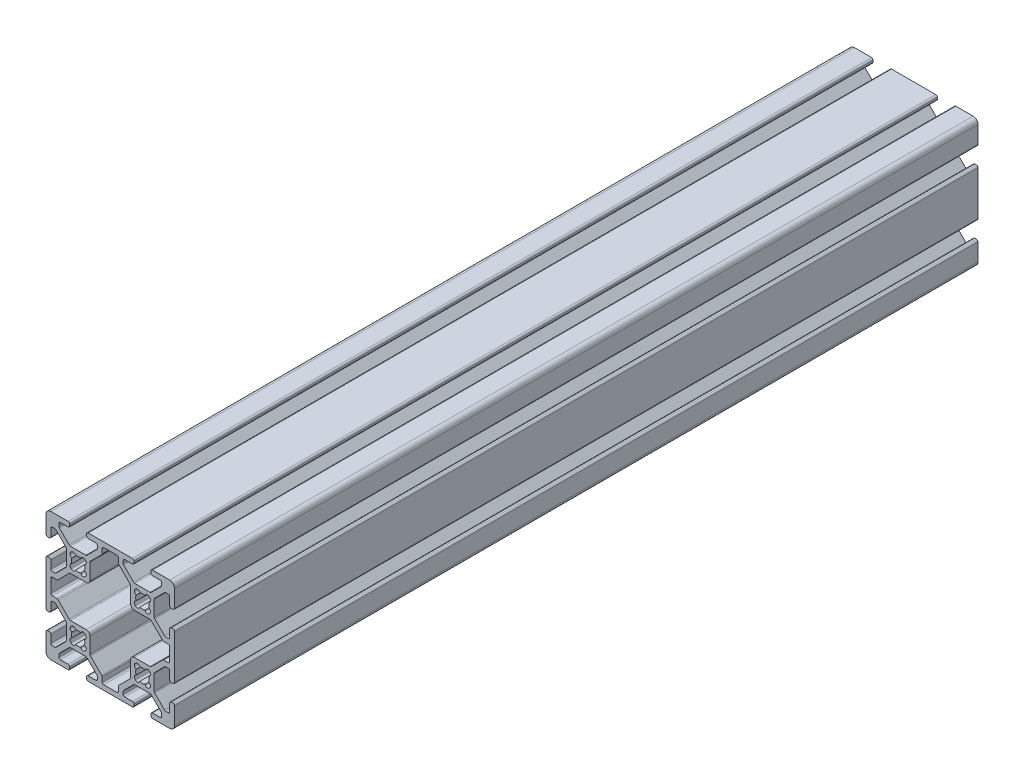
from build123d import *

# Parameters (mm, degrees)
EXTRUDE1_DEPTH = 250


with BuildPart() as part:
    # Sketch1 → Extrude1 (new body)
    with BuildSketch(Plane.XY):
        with BuildLine():
            Line((-22.383919339, -3.655), (-17.616080661, -3.655))
            ThreePointArc((-17.616080661, -3.655), (-17.421677478, -3.693669197), (-17.256870417, -3.803789755))
            Line((-17.256870417, -3.803789755), (-14.153789755, -6.906870417))
            ThreePointArc((-14.153789755, -6.906870417), (-14.043669197, -7.071677478), (-14.005, -7.266080661))
            Line((-14.005, -7.266080661), (-14.005, -7.992))
            ThreePointArc((-14.005, -7.992), (-14.153789755, -8.351210245), (-14.513, -8.5))
            Line((-14.513, -8.5), (-16.862, -8.5))
            ThreePointArc((-16.862, -8.5), (-17.221210245, -8.648789755), (-17.37, -9.008))
            Line((-17.37, -9.008), (-17.37, -9.492))
            ThreePointArc((-17.37, -9.492), (-17.221210245, -9.851210245), (-16.862, -10))
            Line((-16.862, -10), (-3.138, -10))
            ThreePointArc((-3.138, -10), (-2.778789755, -9.851210245), (-2.63, -9.492))
            Line((-2.63, -9.492), (-2.63, -9.008))
            ThreePointArc((-2.63, -9.008), (-2.778789755, -8.648789755), (-3.138, -8.5))
            Line((-3.138, -8.5), (-5.487, -8.5))
            ThreePointArc((-5.487, -8.5), (-5.846210245, -8.351210245), (-5.995, -7.992))
            Line((-5.995, -7.992), (-5.995, -7.266080661))
            ThreePointArc((-5.995, -7.266080661), (-5.956330803, -7.071677478), (-5.846210245, -6.906870417))
            Line((-5.846210245, -6.906870417), (-2.743129583, -3.803789755))
            ThreePointArc((-2.743129583, -3.803789755), (-2.578322522, -3.693669197), (-2.383919339, -3.655))
            Line((-2.383919339, -3.655), (2.383919339, -3.655))
            ThreePointArc((2.383919339, -3.655), (2.578322522, -3.693669197), (2.743129583, -3.803789755))
            Line((2.743129583, -3.803789755), (5.846210245, -6.906870417))
            ThreePointArc((5.846210245, -6.906870417), (5.956330803, -7.071677478), (5.995, -7.266080661))
            Line((5.995, -7.266080661), (5.995, -7.992))
            ThreePointArc((5.995, -7.992), (5.846210245, -8.351210245), (5.487, -8.5))
            Line((5.487, -8.5), (3.138, -8.5))
            ThreePointArc((3.138, -8.5), (2.778789755, -8.648789755), (2.63, -9.008))
            Line((2.63, -9.008), (2.63, -9.492))
            ThreePointArc((2.63, -9.492), (2.778789755, -9.851210245), (3.138, -10))
            Line((3.138, -10), (8.5, -10))
            ThreePointArc((8.5, -10), (9.560660172, -9.560660172), (10, -8.5))
            Line((10, -8.5), (10, -3.138))
            ThreePointArc((10, -3.138), (9.851210245, -2.778789755), (9.492, -2.63))
            Line((9.492, -2.63), (9.008, -2.63))
            ThreePointArc((9.008, -2.63), (8.648789755, -2.778789755), (8.5, -3.138))
            Line((8.5, -3.138), (8.5, -5.487))
            ThreePointArc((8.5, -5.487), (8.351210245, -5.846210245), (7.992, -5.995))
            Line((7.992, -5.995), (7.266080661, -5.995))
            ThreePointArc((7.266080661, -5.995), (7.071677478, -5.956330803), (6.906870417, -5.846210245))
            Line((6.906870417, -5.846210245), (3.803789755, -2.743129583))
            ThreePointArc((3.803789755, -2.743129583), (3.693669197, -2.578322522), (3.655, -2.383919339))
            Line((3.655, -2.383919339), (3.655, 2.383919339))
            ThreePointArc((3.655, 2.383919339), (3.693669197, 2.578322522), (3.803789755, 2.743129583))
            Line((3.803789755, 2.743129583), (6.906870417, 5.846210245))
            ThreePointArc((6.906870417, 5.846210245), (7.071677478, 5.956330803), (7.266080661, 5.995))
            Line((7.266080661, 5.995), (7.992, 5.995))
            ThreePointArc((7.992, 5.995), (8.351210245, 5.846210245), (8.5, 5.487))
            Line((8.5, 5.487), (8.5, 3.138))
            ThreePointArc((8.5, 3.138), (8.648789755, 2.778789755), (9.008, 2.63))
            Line((9.008, 2.63), (9.492, 2.63))
            ThreePointArc((9.492, 2.63), (9.851210245, 2.778789755), (10, 3.138))
            Line((10, 3.138), (10, 16.862))
            ThreePointArc((10, 16.862), (9.851210245, 17.221210245), (9.492, 17.37))
            Line((9.492, 17.37), (9.008, 17.37))
            ThreePointArc((9.008, 17.37), (8.648789755, 17.221210245), (8.5, 16.862))
            Line((8.5, 16.862), (8.5, 14.513))
            ThreePointArc((8.5, 14.513), (8.351210245, 14.153789755), (7.992, 14.005))
            Line((7.992, 14.005), (7.266080661, 14.005))
            ThreePointArc((7.266080661, 14.005), (7.071677478, 14.043669197), (6.906870417, 14.153789755))
            Line((6.906870417, 14.153789755), (3.803789755, 17.256870417))
            ThreePointArc((3.803789755, 17.256870417), (3.693669197, 17.421677478), (3.655, 17.616080661))
            Line((3.655, 17.616080661), (3.655, 22.383919339))
            ThreePointArc((3.655, 22.383919339), (3.693669197, 22.578322522), (3.803789755, 22.743129583))
            Line((3.803789755, 22.743129583), (6.906870417, 25.846210245))
            ThreePointArc((6.906870417, 25.846210245), (7.071677478, 25.956330803), (7.266080661, 25.995))
            Line((7.266080661, 25.995), (7.992, 25.995))
            ThreePointArc((7.992, 25.995), (8.351210245, 25.846210245), (8.5, 25.487))
            Line((8.5, 25.487), (8.5, 23.138))
            ThreePointArc((8.5, 23.138), (8.648789755, 22.778789755), (9.008, 22.63))
            Line((9.008, 22.63), (9.492, 22.63))
            ThreePointArc((9.492, 22.63), (9.851210245, 22.778789755), (10, 23.138))
            Line((10, 23.138), (10, 28.5))
            ThreePointArc((10, 28.5), (9.560660172, 29.560660172), (8.5, 30))
            Line((8.5, 30), (3.138, 30))
            ThreePointArc((3.138, 30), (2.778789755, 29.851210245), (2.63, 29.492))
            Line((2.63, 29.492), (2.63, 29.008))
            ThreePointArc((2.63, 29.008), (2.778789755, 28.648789755), (3.138, 28.5))
            Line((3.138, 28.5), (5.487, 28.5))
            ThreePointArc((5.487, 28.5), (5.846210245, 28.351210245), (5.995, 27.992))
            Line((5.995, 27.992), (5.995, 27.266080661))
            ThreePointArc((5.995, 27.266080661), (5.956330803, 27.071677478), (5.846210245, 26.906870417))
            Line((5.846210245, 26.906870417), (2.743129583, 23.803789755))
            ThreePointArc((2.743129583, 23.803789755), (2.578322522, 23.693669197), (2.383919339, 23.655))
            Line((2.383919339, 23.655), (-2.383919339, 23.655))
            ThreePointArc((-2.383919339, 23.655), (-2.578322522, 23.693669197), (-2.743129583, 23.803789755))
            Line((-2.743129583, 23.803789755), (-5.846210245, 26.906870417))
            ThreePointArc((-5.846210245, 26.906870417), (-5.956330803, 27.071677478), (-5.995, 27.266080661))
            Line((-5.995, 27.266080661), (-5.995, 27.992))
            ThreePointArc((-5.995, 27.992), (-5.846210245, 28.351210245), (-5.487, 28.5))
            Line((-5.487, 28.5), (-3.138, 28.5))
            ThreePointArc((-3.138, 28.5), (-2.778789755, 28.648789755), (-2.63, 29.008))
            Line((-2.63, 29.008), (-2.63, 29.492))
            ThreePointArc((-2.63, 29.492), (-2.778789755, 29.851210245), (-3.138, 30))
            Line((-3.138, 30), (-16.862, 30))
            ThreePointArc((-16.862, 30), (-17.221210245, 29.851210245), (-17.37, 29.492))
            Line((-17.37, 29.492), (-17.37, 29.008))
            ThreePointArc((-17.37, 29.008), (-17.221210245, 28.648789755), (-16.862, 28.5))
            Line((-16.862, 28.5), (-14.513, 28.5))
            ThreePointArc((-14.513, 28.5), (-14.153789755, 28.351210245), (-14.005, 27.992))
            Line((-14.005, 27.992), (-14.005, 27.266080661))
            ThreePointArc((-14.005, 27.266080661), (-14.043669197, 27.071677478), (-14.153789755, 26.906870417))
            Line((-14.153789755, 26.906870417), (-17.256870417, 23.803789755))
            ThreePointArc((-17.256870417, 23.803789755), (-17.421677478, 23.693669197), (-17.616080661, 23.655))
            Line((-17.616080661, 23.655), (-22.383919339, 23.655))
            ThreePointArc((-22.383919339, 23.655), (-22.578322522, 23.693669197), (-22.743129583, 23.803789755))
            Line((-22.743129583, 23.803789755), (-25.846210245, 26.906870417))
            ThreePointArc((-25.846210245, 26.906870417), (-25.956330803, 27.071677478), (-25.995, 27.266080661))
            Line((-25.995, 27.266080661), (-25.995, 27.992))
            ThreePointArc((-25.995, 27.992), (-25.846210245, 28.351210245), (-25.487, 28.5))
            Line((-25.487, 28.5), (-23.138, 28.5))
            ThreePointArc((-23.138, 28.5), (-22.778789755, 28.648789755), (-22.63, 29.008))
            Line((-22.63, 29.008), (-22.63, 29.492))
            ThreePointArc((-22.63, 29.492), (-22.778789755, 29.851210245), (-23.138, 30))
            Line((-23.138, 30), (-28.5, 30))
            ThreePointArc((-28.5, 30), (-29.560660172, 29.560660172), (-30, 28.5))
            Line((-30, 28.5), (-30, 23.138))
            ThreePointArc((-30, 23.138), (-29.851210245, 22.778789755), (-29.492, 22.63))
            Line((-29.492, 22.63), (-29.008, 22.63))
            ThreePointArc((-29.008, 22.63), (-28.648789755, 22.778789755), (-28.5, 23.138))
            Line((-28.5, 23.138), (-28.5, 25.487))
            ThreePointArc((-28.5, 25.487), (-28.351210245, 25.846210245), (-27.992, 25.995))
            Line((-27.992, 25.995), (-27.266080661, 25.995))
            ThreePointArc((-27.266080661, 25.995), (-27.071677478, 25.956330803), (-26.906870417, 25.846210245))
            Line((-26.906870417, 25.846210245), (-23.803789755, 22.743129583))
            ThreePointArc((-23.803789755, 22.743129583), (-23.693669197, 22.578322522), (-23.655, 22.383919339))
            Line((-23.655, 22.383919339), (-23.655, 17.616080661))
            ThreePointArc((-23.655, 17.616080661), (-23.693669197, 17.421677478), (-23.803789755, 17.256870417))
            Line((-23.803789755, 17.256870417), (-26.906870417, 14.153789755))
            ThreePointArc((-26.906870417, 14.153789755), (-27.071677478, 14.043669197), (-27.266080661, 14.005))
            Line((-27.266080661, 14.005), (-27.992, 14.005))
            ThreePointArc((-27.992, 14.005), (-28.351210245, 14.153789755), (-28.5, 14.513))
            Line((-28.5, 14.513), (-28.5, 16.862))
            ThreePointArc((-28.5, 16.862), (-28.648789755, 17.221210245), (-29.008, 17.37))
            Line((-29.008, 17.37), (-29.492, 17.37))
            ThreePointArc((-29.492, 17.37), (-29.851210245, 17.221210245), (-30, 16.862))
            Line((-30, 16.862), (-30, 3.138))
            ThreePointArc((-30, 3.138), (-29.851210245, 2.778789755), (-29.492, 2.63))
            Line((-29.492, 2.63), (-29.008, 2.63))
            ThreePointArc((-29.008, 2.63), (-28.648789755, 2.778789755), (-28.5, 3.138))
            Line((-28.5, 3.138), (-28.5, 5.487))
            ThreePointArc((-28.5, 5.487), (-28.351210245, 5.846210245), (-27.992, 5.995))
            Line((-27.992, 5.995), (-27.266080661, 5.995))
            ThreePointArc((-27.266080661, 5.995), (-27.071677478, 5.956330803), (-26.906870417, 5.846210245))
            Line((-26.906870417, 5.846210245), (-23.803789755, 2.743129583))
            ThreePointArc((-23.803789755, 2.743129583), (-23.693669197, 2.578322522), (-23.655, 2.383919339))
            Line((-23.655, 2.383919339), (-23.655, -2.383919339))
            ThreePointArc((-23.655, -2.383919339), (-23.693669197, -2.578322522), (-23.803789755, -2.743129583))
            Line((-23.803789755, -2.743129583), (-26.906870417, -5.846210245))
            ThreePointArc((-26.906870417, -5.846210245), (-27.071677478, -5.956330803), (-27.266080661, -5.995))
            Line((-27.266080661, -5.995), (-27.992, -5.995))
            ThreePointArc((-27.992, -5.995), (-28.351210245, -5.846210245), (-28.5, -5.487))
            Line((-28.5, -5.487), (-28.5, -3.138))
            ThreePointArc((-28.5, -3.138), (-28.648789755, -2.778789755), (-29.008, -2.63))
            Line((-29.008, -2.63), (-29.492, -2.63))
            ThreePointArc((-29.492, -2.63), (-29.851210245, -2.778789755), (-30, -3.138))
            Line((-30, -3.138), (-30, -8.5))
            ThreePointArc((-30, -8.5), (-29.560660172, -9.560660172), (-28.5, -10))
            Line((-28.5, -10), (-23.138, -10))
            ThreePointArc((-23.138, -10), (-22.778789755, -9.851210245), (-22.63, -9.492))
            Line((-22.63, -9.492), (-22.63, -9.008))
            ThreePointArc((-22.63, -9.008), (-22.778789755, -8.648789755), (-23.138, -8.5))
            Line((-23.138, -8.5), (-25.487, -8.5))
            ThreePointArc((-25.487, -8.5), (-25.846210245, -8.351210245), (-25.995, -7.992))
            Line((-25.995, -7.992), (-25.995, -7.266080661))
            ThreePointArc((-25.995, -7.266080661), (-25.956330803, -7.071677478), (-25.846210245, -6.906870417))
            Line((-25.846210245, -6.906870417), (-22.743129583, -3.803789755))
            ThreePointArc((-22.743129583, -3.803789755), (-22.578322522, -3.693669197), (-22.383919339, -3.655))
        make_face()
        with BuildLine():
            Line((-2.124900844, 17.695494034), (-2.304505966, 17.875099156))
            ThreePointArc((-2.304505966, 17.875099156), (-2.505938017, 18.643532189), (-1.935133506, 19.196023282))
            ThreePointArc((-1.935133506, 19.196023282), (-2.0955, 20), (-1.935133506, 20.803976718))
            ThreePointArc((-1.935133506, 20.803976718), (-2.505938017, 21.356467811), (-2.304505966, 22.124900844))
            Line((-2.304505966, 22.124900844), (-2.124900844, 22.304505966))
            ThreePointArc((-2.124900844, 22.304505966), (-1.356467811, 22.505938017), (-0.803976718, 21.935133506))
            ThreePointArc((-0.803976718, 21.935133506), (0, 22.0955), (0.803976718, 21.935133506))
            ThreePointArc((0.803976718, 21.935133506), (1.356467811, 22.505938017), (2.124900844, 22.304505966))
            Line((2.124900844, 22.304505966), (2.304505966, 22.124900844))
            ThreePointArc((2.304505966, 22.124900844), (2.505938017, 21.356467811), (1.935133506, 20.803976718))
            ThreePointArc((1.935133506, 20.803976718), (2.0955, 20), (1.935133506, 19.196023282))
            ThreePointArc((1.935133506, 19.196023282), (2.505938017, 18.643532189), (2.304505966, 17.875099156))
            Line((2.304505966, 17.875099156), (2.124900844, 17.695494034))
            ThreePointArc((2.124900844, 17.695494034), (1.356467811, 17.494061983), (0.803976718, 18.064866494))
            ThreePointArc((0.803976718, 18.064866494), (0, 17.9045), (-0.803976718, 18.064866494))
            ThreePointArc((-0.803976718, 18.064866494), (-1.356467811, 17.494061983), (-2.124900844, 17.695494034))
        make_face(mode=Mode.SUBTRACT)
        with BuildLine():
            Line((-22.124900844, 17.695494034), (-22.304505966, 17.875099156))
            ThreePointArc((-22.304505966, 17.875099156), (-22.505938017, 18.643532189), (-21.935133506, 19.196023282))
            ThreePointArc((-21.935133506, 19.196023282), (-22.0955, 20), (-21.935133506, 20.803976718))
            ThreePointArc((-21.935133506, 20.803976718), (-22.505938017, 21.356467811), (-22.304505966, 22.124900844))
            Line((-22.304505966, 22.124900844), (-22.124900844, 22.304505966))
            ThreePointArc((-22.124900844, 22.304505966), (-21.356467811, 22.505938017), (-20.803976718, 21.935133506))
            ThreePointArc((-20.803976718, 21.935133506), (-20, 22.0955), (-19.196023282, 21.935133506))
            ThreePointArc((-19.196023282, 21.935133506), (-18.643532189, 22.505938017), (-17.875099156, 22.304505966))
            Line((-17.875099156, 22.304505966), (-17.695494034, 22.124900844))
            ThreePointArc((-17.695494034, 22.124900844), (-17.494061983, 21.356467811), (-18.064866494, 20.803976718))
            ThreePointArc((-18.064866494, 20.803976718), (-17.9045, 20), (-18.064866494, 19.196023282))
            ThreePointArc((-18.064866494, 19.196023282), (-17.494061983, 18.643532189), (-17.695494034, 17.875099156))
            Line((-17.695494034, 17.875099156), (-17.875099156, 17.695494034))
            ThreePointArc((-17.875099156, 17.695494034), (-18.643532189, 17.494061983), (-19.196023282, 18.064866494))
            ThreePointArc((-19.196023282, 18.064866494), (-20, 17.9045), (-20.803976718, 18.064866494))
            ThreePointArc((-20.803976718, 18.064866494), (-21.356467811, 17.494061983), (-22.124900844, 17.695494034))
        make_face(mode=Mode.SUBTRACT)
        with BuildLine():
            Line((-2.124900844, -2.304505966), (-2.304505966, -2.124900844))
            ThreePointArc((-2.304505966, -2.124900844), (-2.505938017, -1.356467811), (-1.935133506, -0.803976718))
            ThreePointArc((-1.935133506, -0.803976718), (-2.0955, 0), (-1.935133506, 0.803976718))
            ThreePointArc((-1.935133506, 0.803976718), (-2.505938017, 1.356467811), (-2.304505966, 2.124900844))
            Line((-2.304505966, 2.124900844), (-2.124900844, 2.304505966))
            ThreePointArc((-2.124900844, 2.304505966), (-1.356467811, 2.505938017), (-0.803976718, 1.935133506))
            ThreePointArc((-0.803976718, 1.935133506), (0, 2.0955), (0.803976718, 1.935133506))
            ThreePointArc((0.803976718, 1.935133506), (1.356467811, 2.505938017), (2.124900844, 2.304505966))
            Line((2.124900844, 2.304505966), (2.304505966, 2.124900844))
            ThreePointArc((2.304505966, 2.124900844), (2.505938017, 1.356467811), (1.935133506, 0.803976718))
            ThreePointArc((1.935133506, 0.803976718), (2.0955, 0), (1.935133506, -0.803976718))
            ThreePointArc((1.935133506, -0.803976718), (2.505938017, -1.356467811), (2.304505966, -2.124900844))
            Line((2.304505966, -2.124900844), (2.124900844, -2.304505966))
            ThreePointArc((2.124900844, -2.304505966), (1.356467811, -2.505938017), (0.803976718, -1.935133506))
            ThreePointArc((0.803976718, -1.935133506), (0, -2.0955), (-0.803976718, -1.935133506))
            ThreePointArc((-0.803976718, -1.935133506), (-1.356467811, -2.505938017), (-2.124900844, -2.304505966))
        make_face(mode=Mode.SUBTRACT)
        with BuildLine():
            Line((-12.505, -7.992), (-12.505, -6.644760318))
            ThreePointArc((-12.505, -6.644760318), (-12.543669197, -6.450357134), (-12.653789755, -6.285550073))
            Line((-12.653789755, -6.285550073), (-16.196210245, -2.743129583))
            ThreePointArc((-16.196210245, -2.743129583), (-16.306330803, -2.578322522), (-16.345, -2.383919339))
            Line((-16.345, -2.383919339), (-16.345, 2.512))
            ThreePointArc((-16.345, 2.512), (-16.679776949, 3.320223051), (-17.488, 3.655))
            Line((-17.488, 3.655), (-22.383919339, 3.655))
            ThreePointArc((-22.383919339, 3.655), (-22.578322522, 3.693669197), (-22.743129583, 3.803789755))
            Line((-22.743129583, 3.803789755), (-26.285550073, 7.346210245))
            ThreePointArc((-26.285550073, 7.346210245), (-26.450357134, 7.456330803), (-26.644760318, 7.495))
            Line((-26.644760318, 7.495), (-27.992, 7.495))
            ThreePointArc((-27.992, 7.495), (-28.351210245, 7.643789755), (-28.5, 8.003))
            Line((-28.5, 8.003), (-28.5, 11.997))
            ThreePointArc((-28.5, 11.997), (-28.351210245, 12.356210245), (-27.992, 12.505))
            Line((-27.992, 12.505), (-26.644760318, 12.505))
            ThreePointArc((-26.644760318, 12.505), (-26.450357134, 12.543669197), (-26.285550073, 12.653789755))
            Line((-26.285550073, 12.653789755), (-22.743129583, 16.196210245))
            ThreePointArc((-22.743129583, 16.196210245), (-22.578322522, 16.306330803), (-22.383919339, 16.345))
            Line((-22.383919339, 16.345), (-17.488, 16.345))
            ThreePointArc((-17.488, 16.345), (-16.679776949, 16.679776949), (-16.345, 17.488))
            Line((-16.345, 17.488), (-16.345, 22.383919339))
            ThreePointArc((-16.345, 22.383919339), (-16.306330803, 22.578322522), (-16.196210245, 22.743129583))
            Line((-16.196210245, 22.743129583), (-12.653789755, 26.285550073))
            ThreePointArc((-12.653789755, 26.285550073), (-12.543669197, 26.450357134), (-12.505, 26.644760318))
            Line((-12.505, 26.644760318), (-12.505, 27.992))
            ThreePointArc((-12.505, 27.992), (-12.356210245, 28.351210245), (-11.997, 28.5))
            Line((-11.997, 28.5), (-8.003, 28.5))
            ThreePointArc((-8.003, 28.5), (-7.643789755, 28.351210245), (-7.495, 27.992))
            Line((-7.495, 27.992), (-7.495, 26.644760318))
            ThreePointArc((-7.495, 26.644760318), (-7.456330803, 26.450357134), (-7.346210245, 26.285550073))
            Line((-7.346210245, 26.285550073), (-3.803789755, 22.743129583))
            ThreePointArc((-3.803789755, 22.743129583), (-3.693669197, 22.578322522), (-3.655, 22.383919339))
            Line((-3.655, 22.383919339), (-3.655, 17.488))
            ThreePointArc((-3.655, 17.488), (-3.320223051, 16.679776949), (-2.512, 16.345))
            Line((-2.512, 16.345), (2.383919339, 16.345))
            ThreePointArc((2.383919339, 16.345), (2.578322522, 16.306330803), (2.743129583, 16.196210245))
            Line((2.743129583, 16.196210245), (6.285550073, 12.653789755))
            ThreePointArc((6.285550073, 12.653789755), (6.450357134, 12.543669197), (6.644760318, 12.505))
            Line((6.644760318, 12.505), (7.992, 12.505))
            ThreePointArc((7.992, 12.505), (8.351210245, 12.356210245), (8.5, 11.997))
            Line((8.5, 11.997), (8.5, 8.003))
            ThreePointArc((8.5, 8.003), (8.351210245, 7.643789755), (7.992, 7.495))
            Line((7.992, 7.495), (6.644760318, 7.495))
            ThreePointArc((6.644760318, 7.495), (6.450357134, 7.456330803), (6.285550073, 7.346210245))
            Line((6.285550073, 7.346210245), (2.743129583, 3.803789755))
            ThreePointArc((2.743129583, 3.803789755), (2.578322522, 3.693669197), (2.383919339, 3.655))
            Line((2.383919339, 3.655), (-2.512, 3.655))
            ThreePointArc((-2.512, 3.655), (-3.320223051, 3.320223051), (-3.655, 2.512))
            Line((-3.655, 2.512), (-3.655, -2.383919339))
            ThreePointArc((-3.655, -2.383919339), (-3.693669197, -2.578322522), (-3.803789755, -2.743129583))
            Line((-3.803789755, -2.743129583), (-7.346210245, -6.285550073))
            ThreePointArc((-7.346210245, -6.285550073), (-7.456330803, -6.450357134), (-7.495, -6.644760318))
            Line((-7.495, -6.644760318), (-7.495, -7.992))
            ThreePointArc((-7.495, -7.992), (-7.643789755, -8.351210245), (-8.003, -8.5))
            Line((-8.003, -8.5), (-11.997, -8.5))
            ThreePointArc((-11.997, -8.5), (-12.356210245, -8.351210245), (-12.505, -7.992))
        make_face(mode=Mode.SUBTRACT)
        with BuildLine():
            Line((-22.124900844, -2.304505966), (-22.304505966, -2.124900844))
            ThreePointArc((-22.304505966, -2.124900844), (-22.505938017, -1.356467811), (-21.935133506, -0.803976718))
            ThreePointArc((-21.935133506, -0.803976718), (-22.0955, 0), (-21.935133506, 0.803976718))
            ThreePointArc((-21.935133506, 0.803976718), (-22.505938017, 1.356467811), (-22.304505966, 2.124900844))
            Line((-22.304505966, 2.124900844), (-22.124900844, 2.304505966))
            ThreePointArc((-22.124900844, 2.304505966), (-21.356467811, 2.505938017), (-20.803976718, 1.935133506))
            ThreePointArc((-20.803976718, 1.935133506), (-20, 2.0955), (-19.196023282, 1.935133506))
            ThreePointArc((-19.196023282, 1.935133506), (-18.643532189, 2.505938017), (-17.875099156, 2.304505966))
            Line((-17.875099156, 2.304505966), (-17.695494034, 2.124900844))
            ThreePointArc((-17.695494034, 2.124900844), (-17.494061983, 1.356467811), (-18.064866494, 0.803976718))
            ThreePointArc((-18.064866494, 0.803976718), (-17.9045, 0), (-18.064866494, -0.803976718))
            ThreePointArc((-18.064866494, -0.803976718), (-17.494061983, -1.356467811), (-17.695494034, -2.124900844))
            Line((-17.695494034, -2.124900844), (-17.875099156, -2.304505966))
            ThreePointArc((-17.875099156, -2.304505966), (-18.643532189, -2.505938017), (-19.196023282, -1.935133506))
            ThreePointArc((-19.196023282, -1.935133506), (-20, -2.0955), (-20.803976718, -1.935133506))
            ThreePointArc((-20.803976718, -1.935133506), (-21.356467811, -2.505938017), (-22.124900844, -2.304505966))
        make_face(mode=Mode.SUBTRACT)
    extrude(amount=-EXTRUDE1_DEPTH)


solid = part.part
